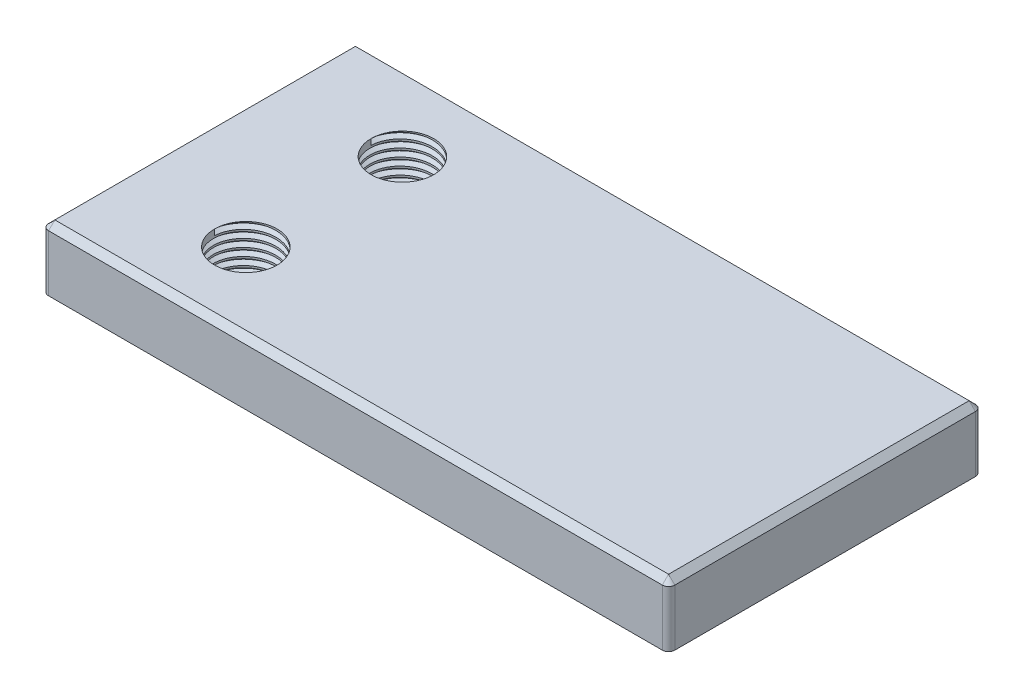
from build123d import *

# Parameters (mm, degrees)
SKETCH2_R           = 5
BOSS_EXTRUDE1_DEPTH = 5
CHAMFER1_SIZE       = 1
THREAD1_PITCH       = 1.25
THREAD2_PITCH       = 1.25


with BuildPart() as part:
    # Sketch2 → Boss-Extrude1 (new, symmetric)
    with BuildSketch(Plane(origin=(0, 0, 0), x_dir=(1, 0, 0), z_dir=(0, 1, 0))):
        with BuildLine():
            Line((-50, 24), (-50, -24))
            ThreePointArc((-50, -24), (-49.707106781, -24.707106781), (-49, -25))
            Line((-49, -25), (49, -25))
            ThreePointArc((49, -25), (49.707106781, -24.707106781), (50, -24))
            Line((50, -24), (50, 24))
            ThreePointArc((50, 24), (49.707106781, 24.707106781), (49, 25))
            Line((49, 25), (-49, 25))
            ThreePointArc((-49, 25), (-49.707106781, 24.707106781), (-50, 24))
        make_face()
        with Locations(Location((-30, 12.5, 0), (0, 0, 270))):
            Circle(SKETCH2_R, mode=Mode.SUBTRACT)
        with Locations(Location((-30, -12.5, 0), (0, 0, 90))):
            Circle(SKETCH2_R, mode=Mode.SUBTRACT)
    extrude(amount=BOSS_EXTRUDE1_DEPTH, both=True)

    # Chamfer1
    chamfer1_edges = [part.edges().sort_by_distance(p)[0] for p in [
        (49.707106781, 5, 24.707106781),
        (50, 5, 0),
        (49.707106781, 5, -24.707106781),
        (0, 5, -25),
        (-49.707106781, 5, -24.707106781),
        (-50, 5, 0),
        (-49.707106781, 5, 24.707106781),
        (0, 5, 25),
    ]]
    chamfer(chamfer1_edges, length=CHAMFER1_SIZE)

    # Thread1: the profile of Thread Profile2 profile screwed along a right-hand helix of 8 turns, 8 arcs to a turn; built about Z, then put on its axis
    thread1_z = Axis((0, 0, 0), (0, 0, 1))
    thread1_corners = [(4.9997, 0, -0.000173205), (5.676582344, 0, 0.390624998), (5.676582344, 0, 0.546874998), (4.9997, 0, 0.937673202)]
    with BuildLine(mode=Mode.PRIVATE) as thread1_profile:
        Line(thread1_corners[0], thread1_corners[1])
        Line(thread1_corners[1], thread1_corners[2])
        Line(thread1_corners[2], thread1_corners[3])
        Line(thread1_corners[3], thread1_corners[0])
    thread1_cap = Face(thread1_profile.wire())
    thread1_turn_angles = [0, 22.5, 45, 67.5, 90, 112.5, 135, 157.5, 180, 202.5, 225, 247.5, 270, 292.5, 315, 337.5, 360]
    thread1_turn_weights = [1, 0.9238795325112867, 1, 0.9238795325112867, 1, 0.9238795325112867, 1, 0.9238795325112867, 1, 0.9238795325112867, 1, 0.9238795325112867, 1, 0.9238795325112867, 1, 0.9238795325112867, 1]
    thread1_turn_rails = [Edge.make_bspline([Vector(p[0], p[1], 0).rotate(thread1_z, thread1_turn_angles[k]) / thread1_turn_weights[k] + Vector(0, 0, p[2] + THREAD1_PITCH * thread1_turn_angles[k] / 360) for k in range(17)], [0, 0, 0, 1, 1, 2, 2, 3, 3, 4, 4, 5, 5, 6, 6, 7, 7, 8, 8, 8], 2, thread1_turn_weights) for p in thread1_corners]
    thread1_turn_sides = [Face.make_surface_from_curves(thread1_turn_rails[p[0]], thread1_turn_rails[p[1]]) for p in [(0, 1), (1, 2), (2, 3), (3, 0)]]
    thread1 = Plane(origin=(-30, 5, -12.5), x_dir=(-1, 0, 0), z_dir=(0, -1, 0)) * Solid(Shell([*[p.moved(Location((0, 0, THREAD1_PITCH * i))) for i in range(8) for p in thread1_turn_sides], thread1_cap, thread1_cap.rotate(thread1_z, 2880).moved(Location((0, 0, THREAD1_PITCH * 2880 / 360)))]))
    add(thread1, mode=Mode.SUBTRACT)

    # Thread2: the profile of Thread Profile3 profile screwed along a right-hand helix of 8 turns, 8 arcs to a turn; built about Z, then put on its axis
    thread2_z = Axis((0, 0, 0), (0, 0, 1))
    thread2_corners = [(4.9997, 0, -0.000173205), (5.676582344, 0, 0.390624998), (5.676582344, 0, 0.546874998), (4.9997, 0, 0.937673202)]
    with BuildLine(mode=Mode.PRIVATE) as thread2_profile:
        Line(thread2_corners[0], thread2_corners[1])
        Line(thread2_corners[1], thread2_corners[2])
        Line(thread2_corners[2], thread2_corners[3])
        Line(thread2_corners[3], thread2_corners[0])
    thread2_cap = Face(thread2_profile.wire())
    thread2_turn_angles = [0, 22.5, 45, 67.5, 90, 112.5, 135, 157.5, 180, 202.5, 225, 247.5, 270, 292.5, 315, 337.5, 360]
    thread2_turn_weights = [1, 0.9238795325112867, 1, 0.9238795325112867, 1, 0.9238795325112867, 1, 0.9238795325112867, 1, 0.9238795325112867, 1, 0.9238795325112867, 1, 0.9238795325112867, 1, 0.9238795325112867, 1]
    thread2_turn_rails = [Edge.make_bspline([Vector(p[0], p[1], 0).rotate(thread2_z, thread2_turn_angles[k]) / thread2_turn_weights[k] + Vector(0, 0, p[2] + THREAD2_PITCH * thread2_turn_angles[k] / 360) for k in range(17)], [0, 0, 0, 1, 1, 2, 2, 3, 3, 4, 4, 5, 5, 6, 6, 7, 7, 8, 8, 8], 2, thread2_turn_weights) for p in thread2_corners]
    thread2_turn_sides = [Face.make_surface_from_curves(thread2_turn_rails[p[0]], thread2_turn_rails[p[1]]) for p in [(0, 1), (1, 2), (2, 3), (3, 0)]]
    thread2 = Plane(origin=(-30, 5, 12.5), x_dir=(-1, 0, 0), z_dir=(0, -1, 0)) * Solid(Shell([*[p.moved(Location((0, 0, THREAD2_PITCH * i))) for i in range(8) for p in thread2_turn_sides], thread2_cap, thread2_cap.rotate(thread2_z, 2880).moved(Location((0, 0, THREAD2_PITCH * 2880 / 360)))]))
    add(thread2, mode=Mode.SUBTRACT)


solid = part.part
